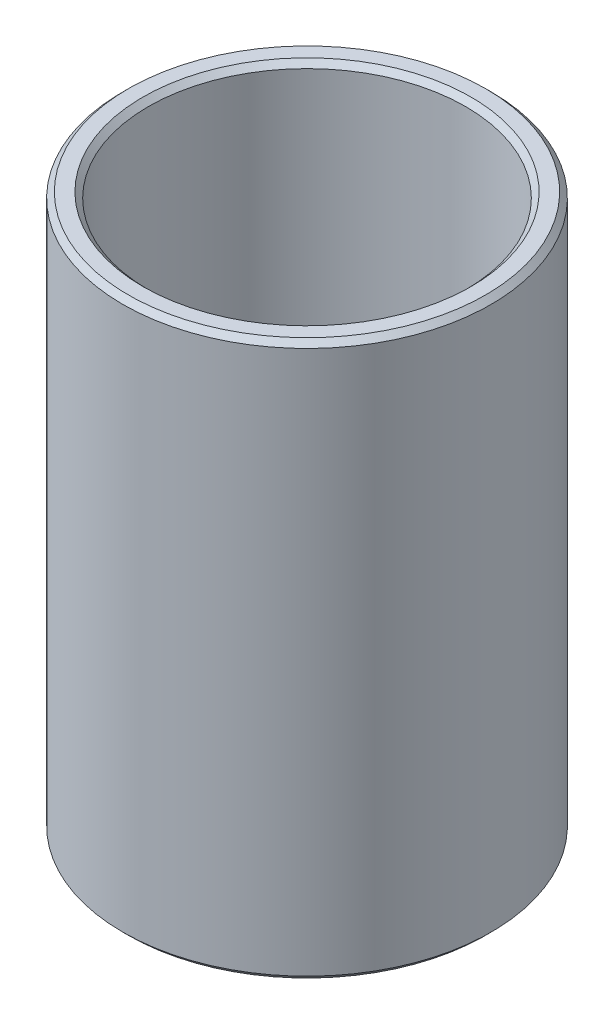
from build123d import *

# Parameters (mm, degrees)
SKETCH1_R           = 50
BOSS_EXTRUDE1_DEPTH = 150.586596938
SKETCH2_R           = 43.079199853
CUT_EXTRUDE1_DEPTH  = 167.362024445
CHAMFER1_SIZE       = 1.486758935


with BuildPart() as part:
    # Sketch1 → Boss-Extrude1 (new body)
    with BuildSketch(Plane(origin=(0, 0, 0), x_dir=(1, 0, 0), z_dir=(0, 1, 0))):
        Circle(SKETCH1_R)
    extrude(amount=BOSS_EXTRUDE1_DEPTH)

    # Sketch2 → Cut-Extrude1 (cut, through all)
    with BuildSketch(Plane(origin=(0, 0, 0), x_dir=(1, 0, 0), z_dir=(0, 1, 0))):
        Circle(SKETCH2_R)
    extrude(amount=CUT_EXTRUDE1_DEPTH, mode=Mode.SUBTRACT)

    # Chamfer1
    chamfer1_edges = [part.edges().sort_by_distance(p)[0] for p in [
        (-43.079199853, 150.586596938, 0),
        (-43.079199853, 0, 0),
        (-50, 0, 0),
        (-50, 150.586596938, 0),
    ]]
    chamfer(chamfer1_edges, length=CHAMFER1_SIZE)


solid = part.part
